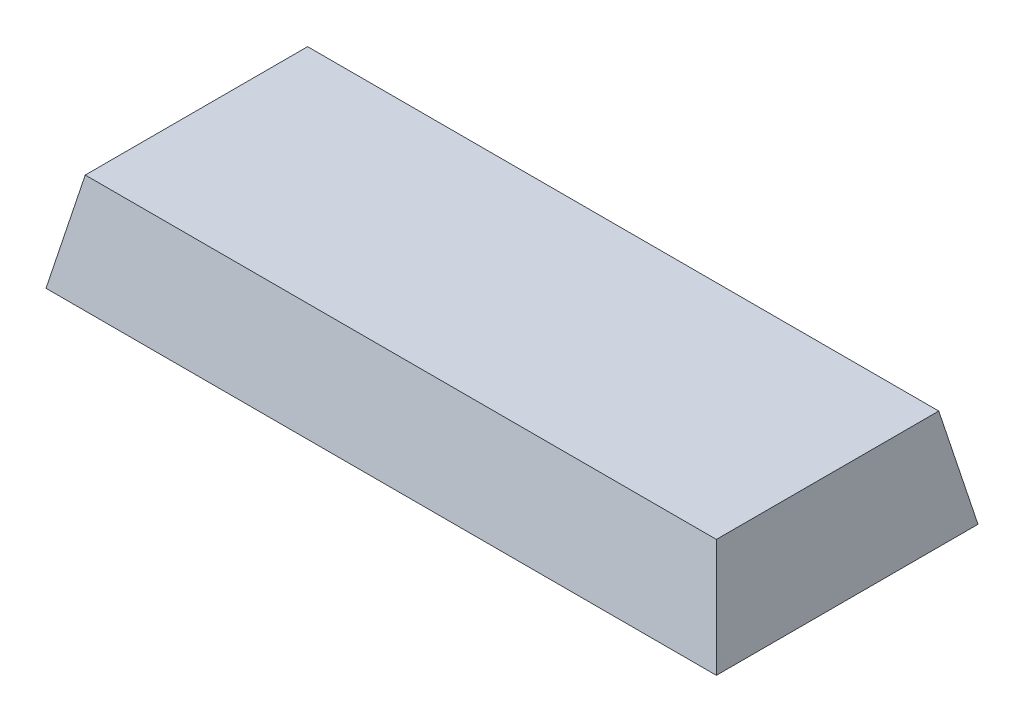
from build123d import *

# Parameters (mm, degrees)
SKETCH1_W               = 20.5
SKETCH1_H               = 8
BOSS_EXTRUDE1_DEPTH     = 3
CUT_EXTRUDE1_DEPTH      = 23.209232315
CUT_EXTRUDE1_DEPTH_BACK = 23.209232315
CUT_EXTRUDE2_DEPTH      = 23.209232315
CUT_EXTRUDE2_DEPTH_BACK = 23.209232315
SKETCH4_R               = 1.8
CUT_EXTRUDE3_DEPTH      = 0.8
SKETCH5_W               = 8
SKETCH5_H               = 1
BOSS_EXTRUDE2_DEPTH     = 2
FILLET1_R               = 4


with BuildPart() as part:
    # Sketch1 → Boss-Extrude1 (new body)
    with BuildSketch(Plane(origin=(0, 0, 0), x_dir=(1, 0, 0), z_dir=(0, 1, 0))):
        with Locations((10.25, 4)):
            Rectangle(SKETCH1_W, SKETCH1_H)
    extrude(amount=BOSS_EXTRUDE1_DEPTH)

    # Sketch2 → Cut-Extrude1 (cut, two sides: drawn at the far end of the back side and taken through both)
    with BuildSketch(Plane.XY.offset(-CUT_EXTRUDE1_DEPTH_BACK)):
        Polygon((0, 0), (0.6, 3), (0, 3), align=None)
        Polygon((20.5, 0), (19.9, 3), (20.5, 3), align=None)
    extrude(amount=CUT_EXTRUDE1_DEPTH + CUT_EXTRUDE1_DEPTH_BACK, mode=Mode.SUBTRACT)

    # Sketch3 → Cut-Extrude2 (cut, two sides: drawn at the far end of the back side and taken through both)
    with BuildSketch(Plane(origin=(0, 0, 0), x_dir=(0, 0, -1), z_dir=(1, 0, 0)).offset(-CUT_EXTRUDE2_DEPTH_BACK)):
        Polygon((0, 0), (0.6, 3), (0, 3), align=None)
        Polygon((8, 3), (7.4, 3), (8, 0), align=None)
    extrude(amount=CUT_EXTRUDE2_DEPTH + CUT_EXTRUDE2_DEPTH_BACK, mode=Mode.SUBTRACT)

    # Sketch4 → Cut-Extrude3 (cut)
    with BuildSketch(Plane.XZ):
        with Locations(Location((10.25000125, -3.75, 0), (0, 0, 270))):
            Circle(SKETCH4_R)
    extrude(amount=-CUT_EXTRUDE3_DEPTH, mode=Mode.SUBTRACT)

    # Sketch5 → Boss-Extrude2 (add)
    with BuildSketch(Plane.XZ):
        with Locations((10.250011, -7.5)):
            Rectangle(SKETCH5_W, SKETCH5_H)
    extrude(amount=BOSS_EXTRUDE2_DEPTH)

    # Fillet1
    # the kernel refuses this fillet: 4 mm, written as the material it takes off along each edge
    with BuildSketch(Plane(origin=(14.250011, -2, -16.660254038), x_dir=(0, 1, 0), z_dir=(0, 0, 1)), Plane(origin=(6.250011, -2, 1.660254038), x_dir=(0, 1, 0), z_dir=(0, 0, -1))) as fillet1_piece_1:
        with BuildLine():
            CenterArc((4, 3.464101615), FILLET1_R, 180, 60)
            Line((0, 3.464101615), (-0.08, 3.464101615))
            Line((-0.08, 3.464101615), (-0.08, 0))
            Line((-0.08, 0), (0, -0.08))
            ThreePointArc((0, -0.08), (1, -0.08), (1.96, -0.069282032))
            Line((1.96, -0.069282032), (2, 0))
        make_face()
    extrude(amount=18.320508076, mode=Mode.SUBTRACT)


solid = part.part
